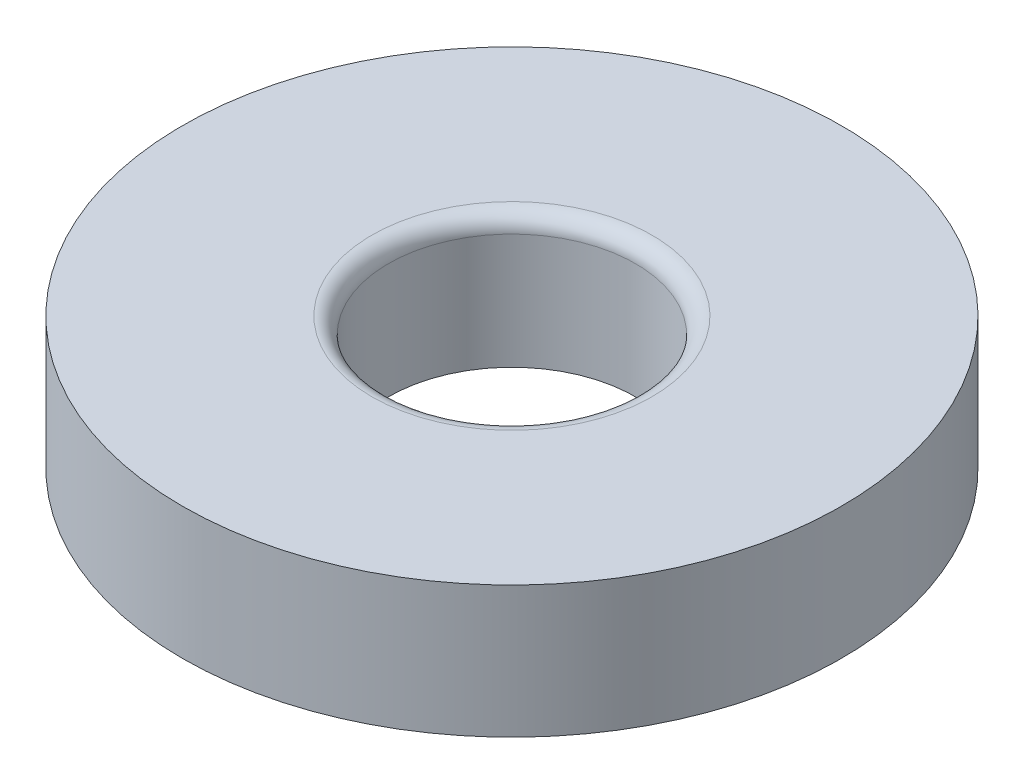
from build123d import *

# Parameters (mm, degrees)
SKETCH1_R           = 20
BOSS_EXTRUDE1_DEPTH = 8
SKETCH2_R           = 7.5
CUT_EXTRUDE1_DEPTH  = 30.393876913
FILLET1_R           = 1


with BuildPart() as part:
    # Sketch1 → Boss-Extrude1 (new body)
    with BuildSketch(Plane(origin=(0, 0, 0), x_dir=(1, 0, 0), z_dir=(0, 1, 0))):
        Circle(SKETCH1_R)
    extrude(amount=BOSS_EXTRUDE1_DEPTH)

    # Sketch2 → Cut-Extrude1 (cut, through all)
    with BuildSketch(Plane(origin=(0, 8, 0), x_dir=(1, 0, 0), z_dir=(0, 1, 0))):
        Circle(SKETCH2_R)
    extrude(amount=-CUT_EXTRUDE1_DEPTH, mode=Mode.SUBTRACT)

    # Fillet1
    fillet1_edges = [part.edges().sort_by_distance(p)[0] for p in [
        (-7.5, 8, 0),
    ]]
    fillet(fillet1_edges, radius=FILLET1_R)


solid = part.part
